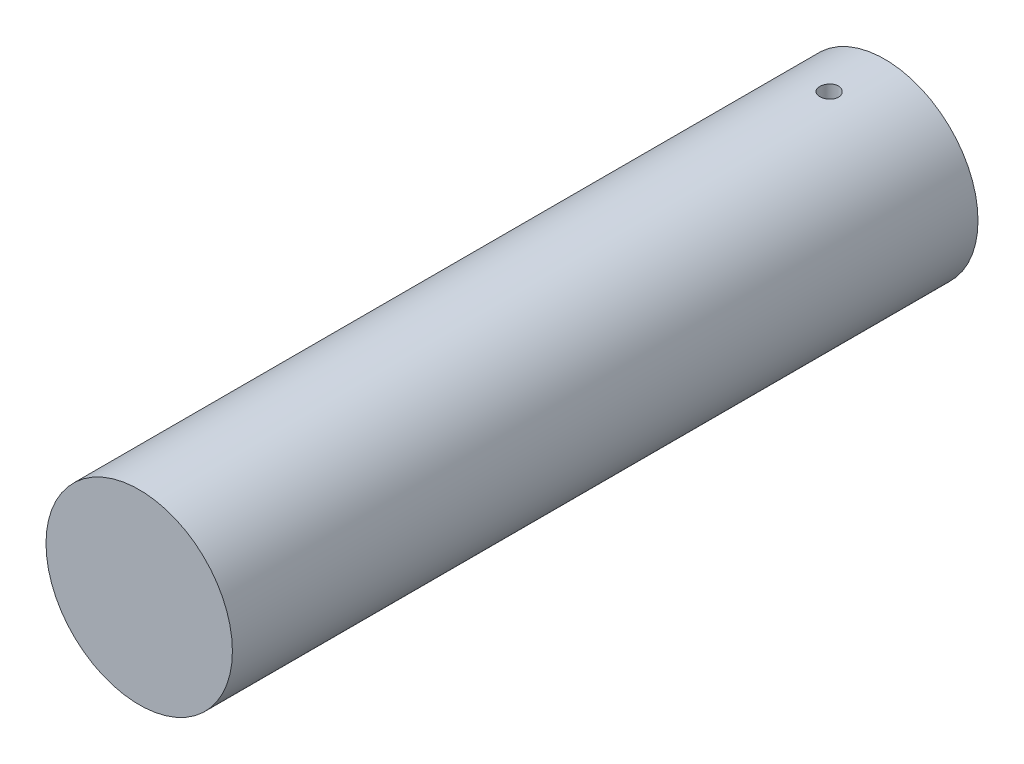
from build123d import *

# Parameters (mm, degrees)
SCHIZZO1_R                    = 50
ESTRUSIONE_ESTRUSIONE1_DEPTH  = 400
TAGLIO_ESTRUSIONE1_DEPTH      = 407.201920232
TAGLIO_ESTRUSIONE1_DEPTH_BACK = 407.201920232
SCHIZZO2_R                    = 5


with BuildPart() as part:
    # Schizzo1 → Estrusione-Estrusione1 (new body)
    with BuildSketch(Plane.XY):
        Circle(SCHIZZO1_R)
    extrude(amount=ESTRUSIONE_ESTRUSIONE1_DEPTH)

    # Schizzo2 → Taglio-Estrusione1 (cut, two sides: drawn at the far end of the back side and taken through both)
    with BuildSketch(Plane(origin=(0, 0, 0), x_dir=(1, 0, 0), z_dir=(0, 1, 0)).offset(-TAGLIO_ESTRUSIONE1_DEPTH_BACK)):
        with Locations((0, -29.895202987)):
            Circle(SCHIZZO2_R)
    extrude(amount=TAGLIO_ESTRUSIONE1_DEPTH + TAGLIO_ESTRUSIONE1_DEPTH_BACK, mode=Mode.SUBTRACT)


solid = part.part
